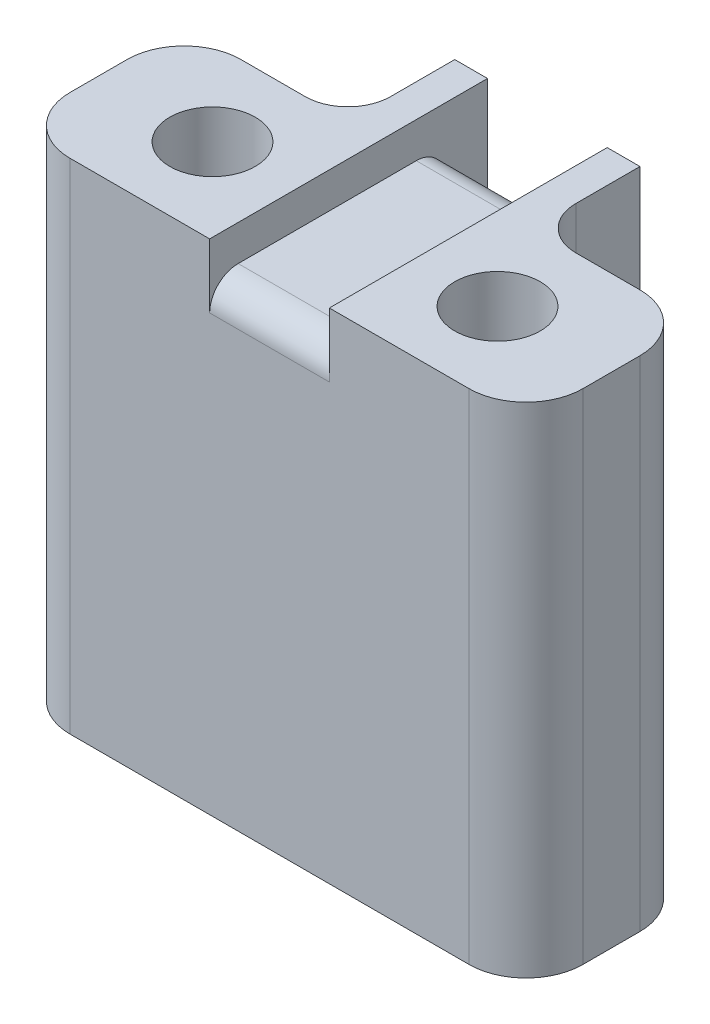
from build123d import *

# Parameters (mm, degrees)
SKETCH1_W           = 18
SKETCH1_H           = 6
BOSS_EXTRUDE1_DEPTH = 17.5
SKETCH2_R           = 1.5
CUT_EXTRUDE1_DEPTH  = 20.906029237
FILLET1_R           = 2
BOSS_EXTRUDE2_DEPTH = 3.75
SKETCH4_W           = 4.2
SKETCH4_H           = 4
BOSS_EXTRUDE3_DEPTH = 2.25
SKETCH5_W           = 4.2
SKETCH5_H           = 8.25
CUT_EXTRUDE2_DEPTH  = 1.25
FILLET5_R           = 1
FILLET6_R           = 1.5
FILLET7_R           = 0.75


with BuildPart() as part:
    # Sketch1 → Boss-Extrude1 (new body)
    with BuildSketch(Plane(origin=(0, 0, 0), x_dir=(1, 0, 0), z_dir=(0, 1, 0))):
        Rectangle(SKETCH1_W, SKETCH1_H)
    extrude(amount=BOSS_EXTRUDE1_DEPTH)

    # Sketch2 → Cut-Extrude1 (cut, through all)
    with BuildSketch(Plane(origin=(0, 17.5, 0), x_dir=(1, 0, 0), z_dir=(0, 1, 0))):
        with Locations(Location((-5, 0, 0), (0, 0, 270))):
            Circle(SKETCH2_R)
        with Locations(Location((5, 0, 0), (0, 0, 90))):
            Circle(SKETCH2_R)
    extrude(amount=-CUT_EXTRUDE1_DEPTH, mode=Mode.SUBTRACT)

    # Fillet1
    fillet1_edges = [part.edges().sort_by_distance(p)[0] for p in [
        (9, 8.75, 3),
        (-9, 8.75, 3),
        (-9, 8.75, -3),
        (9, 8.75, -3),
    ]]
    fillet(fillet1_edges, radius=FILLET1_R)

    # Sketch3 → Boss-Extrude2 (add)
    with BuildSketch(Plane(origin=(0, 0, -3), x_dir=(-1, 0, 0), z_dir=(0, 0, -1))):
        Polygon((-3.25, 17.5), (-3.25, 13), (3.25, 13), (3.25, 17.5), (2.1, 17.5), (2.1, 13.5), (-2.1, 13.5), (-2.1, 17.5), align=None)
    extrude(amount=BOSS_EXTRUDE2_DEPTH)

    # Sketch4 → Boss-Extrude3 (add)
    with BuildSketch(Plane(origin=(0, 0, -3), x_dir=(-1, 0, 0), z_dir=(0, 0, -1))):
        with Locations((0, 15.5)):
            Rectangle(SKETCH4_W, SKETCH4_H)
    extrude(amount=BOSS_EXTRUDE3_DEPTH)

    # Sketch5 → Cut-Extrude2 (cut)
    with BuildSketch(Plane(origin=(0, 17.5, 0), x_dir=(1, 0, 0), z_dir=(0, 1, 0))):
        with Locations((0, 1.125)):
            Rectangle(SKETCH5_W, SKETCH5_H)
    extrude(amount=-CUT_EXTRUDE2_DEPTH, mode=Mode.SUBTRACT)

    # Fillet5
    fillet5_edges = [part.edges().sort_by_distance(p)[0] for p in [
        (0, 16.25, 3),
        (0, 16.25, -5.25),
    ]]
    fillet(fillet5_edges, radius=FILLET5_R)

    # Fillet6
    fillet6_edges = [part.edges().sort_by_distance(p)[0] for p in [
        (0, 13, -3),
        (-3.25, 15.25, -3),
        (3.25, 15.25, -3),
    ]]
    fillet(fillet6_edges, radius=FILLET6_R)

    # Fillet7
    # the kernel refuses this fillet: 0.75 mm, written as the material it takes off along each edge
    with BuildSketch(Plane(origin=(5.125, 13, -6.75), x_dir=(0, 1, 0), z_dir=(-1, 0, 0))) as fillet7_piece_1:
        with BuildLine():
            CenterArc((FILLET7_R, -FILLET7_R), FILLET7_R, 90, 90)
            Line((0, -FILLET7_R), (0, 0))
            Line((0, 0), (FILLET7_R, 0))
        make_face()
    extrude(amount=10.25, mode=Mode.SUBTRACT)


solid = part.part
